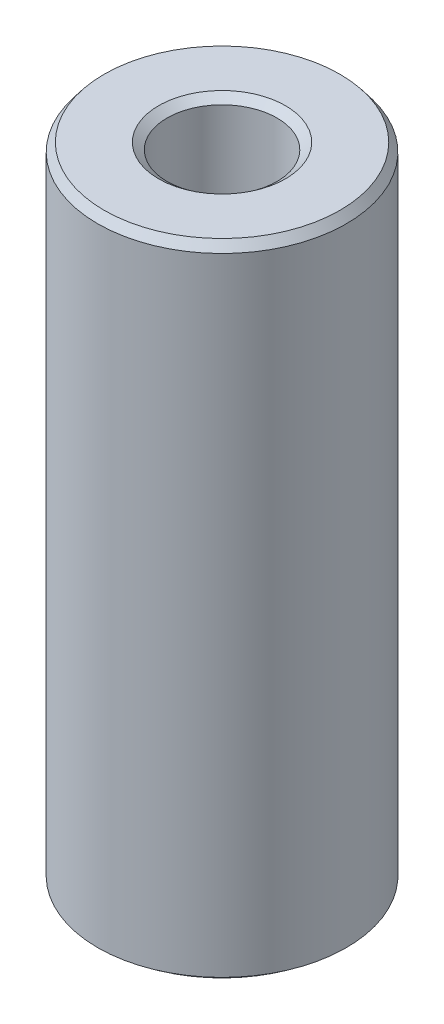
from build123d import *
from OCP.BRepFilletAPI import BRepFilletAPI_MakeChamfer

# Parameters (mm, degrees)
SKETCH1_R           = 32.5
BOSS_EXTRUDE1_DEPTH = 167.745234
SKETCH2_R           = 14.376990571
CUT_EXTRUDE1_DEPTH  = 174.92804124
CHAMFER1_SIZE       = 2.201775744
CHAMFER1_SIZE2      = 1.684347731


with BuildPart() as part:
    # Sketch1 → Boss-Extrude1 (new body)
    with BuildSketch(Plane(origin=(0, 0, 0), x_dir=(1, 0, 0), z_dir=(0, 1, 0))):
        Circle(SKETCH1_R)
    extrude(amount=BOSS_EXTRUDE1_DEPTH)

    # Sketch2 → Cut-Extrude1 (cut, through all)
    with BuildSketch(Plane(origin=(0, 0, 0), x_dir=(1, 0, 0), z_dir=(0, 1, 0))):
        Circle(SKETCH2_R)
    extrude(amount=CUT_EXTRUDE1_DEPTH, mode=Mode.SUBTRACT)

    # Chamfer1: one chamfer whose edges measure the first distance from different faces: ONE call of the kernel's chamfer builder (chamfer() names one face for all edges)
    chamfer1_edges_1 = [part.edges().sort_by_distance(p)[0] for p in [
        (-14.376990571, 167.745234, 0),
    ]]
    chamfer1_side_1 = [part.faces().sort_by_distance(p)[0] for p in [
        (-31.580761184, 167.745234, 0),
    ]]
    chamfer1_edges_2 = [part.edges().sort_by_distance(p)[0] for p in [
        (-14.376990571, 0, 0),
    ]]
    chamfer1_side_2 = [part.faces().sort_by_distance(p)[0] for p in [
        (-14.376990571, 83.872617, 0),
    ]]
    chamfer1_edges_3 = [part.edges().sort_by_distance(p)[0] for p in [
        (-32.5, 0, 0),
    ]]
    chamfer1_side_3 = [part.faces().sort_by_distance(p)[0] for p in [
        (-31.580761184, 0, 0),
    ]]
    chamfer1_edges_4 = [part.edges().sort_by_distance(p)[0] for p in [
        (-32.5, 167.745234, 0),
    ]]
    chamfer1_side_4 = [part.faces().sort_by_distance(p)[0] for p in [
        (-32.5, 83.872617, 0),
    ]]
    chamfer1 = BRepFilletAPI_MakeChamfer(part.part.solid().wrapped)
    for e in chamfer1_edges_1:
        chamfer1.Add(CHAMFER1_SIZE, CHAMFER1_SIZE2, e.wrapped, chamfer1_side_1[0].wrapped)  # the first distance lies on this face
    for e in chamfer1_edges_2:
        chamfer1.Add(CHAMFER1_SIZE, CHAMFER1_SIZE2, e.wrapped, chamfer1_side_2[0].wrapped)  # the first distance lies on this face
    for e in chamfer1_edges_3:
        chamfer1.Add(CHAMFER1_SIZE, CHAMFER1_SIZE2, e.wrapped, chamfer1_side_3[0].wrapped)  # the first distance lies on this face
    for e in chamfer1_edges_4:
        chamfer1.Add(CHAMFER1_SIZE, CHAMFER1_SIZE2, e.wrapped, chamfer1_side_4[0].wrapped)  # the first distance lies on this face
    add(Compound.cast(chamfer1.Shape()), mode=Mode.REPLACE)


solid = part.part
